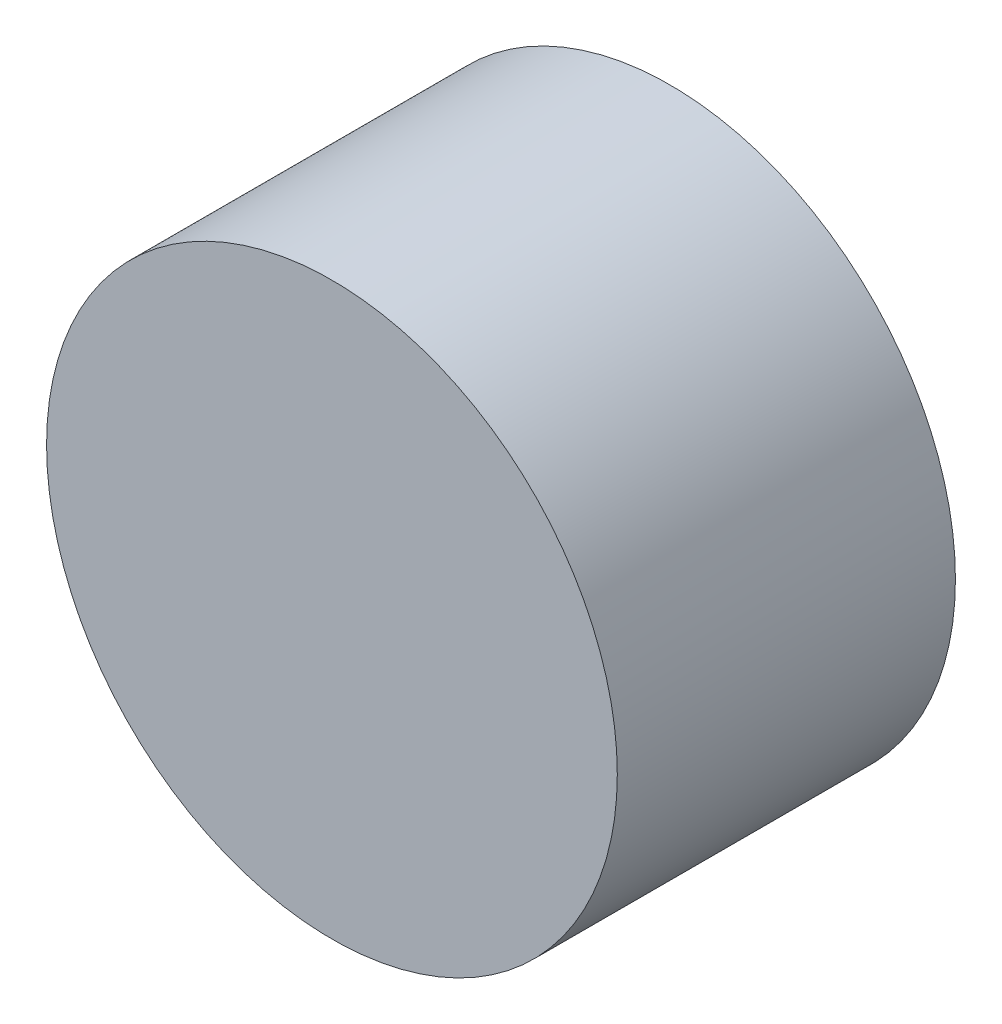
from build123d import *

# Parameters (mm, degrees)
BOSS_EXTRUDE1_OUTLINE_R = 21.1
BOSS_EXTRUDE1_DEPTH     = 25


# Read off the part's stored shape, not the designer's step: Boss-Extrude1
with BuildPart() as part:
    # Boss-Extrude1 outline → Boss-Extrude1 (new body)
    with BuildSketch(Plane.XY.offset(29)):
        Circle(BOSS_EXTRUDE1_OUTLINE_R)
    extrude(amount=BOSS_EXTRUDE1_DEPTH)


solid = part.part
